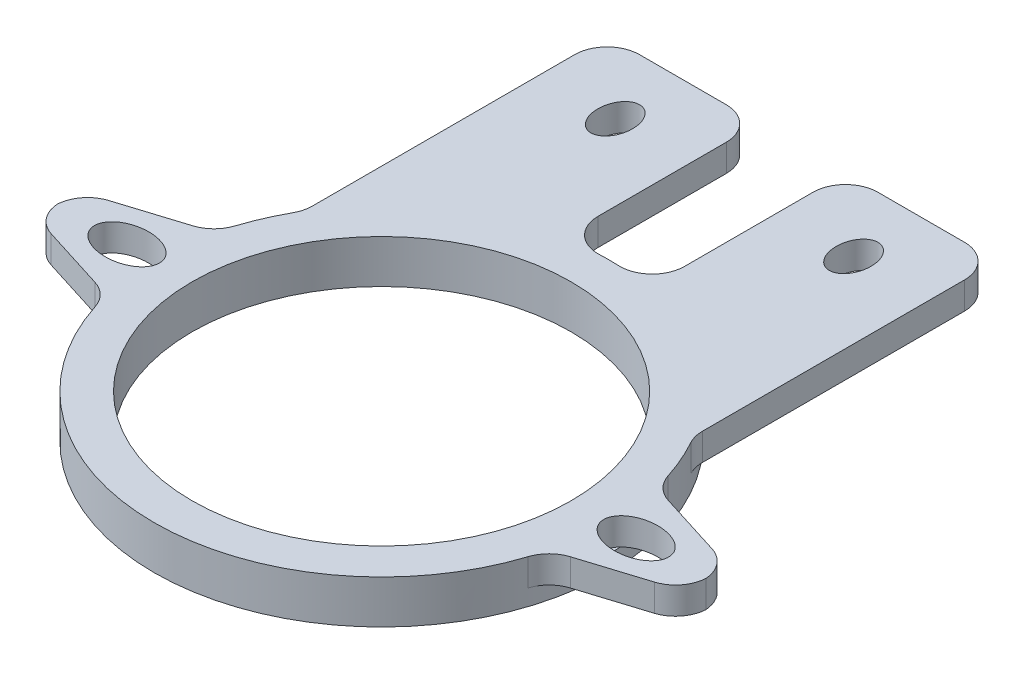
from build123d import *

# Parameters (mm, degrees)
SKETCH1_R           = 21
SKETCH1_R_2         = 17.5
BOSS_EXTRUDE1_DEPTH = 4
BOSS_EXTRUDE2_DEPTH = 2.5
SKETCH3_RX          = 2.25
SKETCH3_RY          = 1.6
SKETCH3_RX_2        = 3
SKETCH3_RY_2        = 2
CUT_EXTRUDE1_DEPTH  = 2.5
FILLET1_R           = 3


with BuildPart() as part:
    # Sketch1 → Boss-Extrude1 (new body)
    with BuildSketch(Plane(origin=(0, 0, 0), x_dir=(1, 0, 0), z_dir=(0, 1, 0))):
        with Locations(Location((0, 0, 0), (0, 0, 270))):
            Circle(SKETCH1_R)
        with Locations(Location((0, 0, 0), (0, 0, 270))):
            Circle(SKETCH1_R_2, mode=Mode.SUBTRACT)
    extrude(amount=BOSS_EXTRUDE1_DEPTH)

    # Sketch2 → Boss-Extrude2 (add)
    with BuildSketch(Plane(origin=(0, 4, 0), x_dir=(1, 0, 0), z_dir=(0, 1, 0))):
        Polygon((-20.396078054, 5), (-29.935470069, 2), (-29.935470069, -2), (-20.396078054, -5), align=None)
        Polygon((20.396078054, -5), (20.396078054, 5), (29.935470069, 2), (29.935470069, -2), align=None)
        Polygon((-18, 10.816653826), (-18, 38.816653826), (-4, 38.816653826), (-4, 20.615528128), align=None)
        Polygon((4, 20.615528128), (18, 10.816653826), (18, 38.816653826), (4, 38.816653826), align=None)
    extrude(amount=-BOSS_EXTRUDE2_DEPTH)

    # Sketch3 → Cut-Extrude1 (cut)
    with BuildSketch(Plane(origin=(0, 4, 0), x_dir=(1, 0, 0), z_dir=(0, 1, 0))):
        with Locations(Location((-11, 32.566653826), (0, 0, 90))):
            Ellipse(SKETCH3_RX, SKETCH3_RY)
        with Locations(Location((11, 32.566653826), (0, 0, 90))):
            Ellipse(SKETCH3_RX, SKETCH3_RY)
        with Locations((-23.5, 0)):
            Ellipse(SKETCH3_RX_2, SKETCH3_RY_2)
        with Locations(Location((23.5, 0), (0, 0, 180))):
            Ellipse(SKETCH3_RX_2, SKETCH3_RY_2)
    extrude(amount=-CUT_EXTRUDE1_DEPTH, mode=Mode.SUBTRACT)

    # Fillet1
    # the kernel refuses this fillet: 3 mm, written as the material it adds along each edge
    with BuildSketch(Plane(origin=(-18, 4, -10.816653826), x_dir=(-0.4996806126682358, 0, 0.8662097236371205), z_dir=(0, -1, 0))) as fillet1_piece_1:
        with BuildLine():
            CenterArc((0.804085058, 2.999521034), FILLET1_R, 240.021128247, 28.955024372)
            Line((-0.69495678, 0.400891863), (0, 0))
            ThreePointArc((0, 0), (0.375239694, 0.003352764), (0.750479387, 0))
        make_face()
    extrude(amount=2.5)
    with BuildSketch(Plane(origin=(-4, 4, -20.615528128), x_dir=(0.9932025912341629, 0, -0.11639850843436236), z_dir=(0, -1, 0))) as fillet1_piece_2:
        with BuildLine():
            CenterArc((3.371129229, -2.991569999), FILLET1_R, 94.296279982, 92.388015463)
            Line((0.391521455, -3.340765524), (0, 0))
            ThreePointArc((0, 0), (1.57319364, -0.05901001), (3.14638728, 0))
        make_face()
    extrude(amount=2.5)
    with BuildSketch(Plane(origin=(4, 4, -20.615528128), x_dir=(-0.9932025912341629, 0, -0.11639850843436243), z_dir=(0, -1, 0))) as fillet1_piece_3:
        with BuildLine():
            CenterArc((3.371129229, 2.991569999), FILLET1_R, 173.315704555, 92.388015463)
            Line((0.391521455, 3.340765524), (0, 0))
            ThreePointArc((0, 0), (1.57319364, 0.05901001), (3.14638728, 0))
        make_face()
    extrude(amount=2.5)
    with BuildSketch(Plane(origin=(18, 4, -10.816653826), x_dir=(0.4996806126682291, 0, 0.8662097236371242), z_dir=(0, -1, 0))) as fillet1_piece_4:
        with BuildLine():
            CenterArc((0.804085058, -2.999521034), FILLET1_R, 91.023847381, 28.955024372)
            Line((-0.69495678, -0.400891863), (0, 0))
            ThreePointArc((0, 0), (0.375239694, -0.003352764), (0.750479387, 0))
        make_face()
    extrude(amount=2.5)
    with BuildSketch(Plane(origin=(20.396078054, 4, -5), x_dir=(-0.2729089679529711, 0, -0.9620398615498447), z_dir=(0, -1, 0)), Plane(origin=(-20.396078054, 4, 5), x_dir=(0.2729089679529655, 0, 0.9620398615498462), z_dir=(0, -1, 0))) as fillet1_piece_5:
        with BuildLine():
            CenterArc((1.620157081, 2.998054992), FILLET1_R, 213.295044107, 54.641661907)
            Line((-0.88740746, 1.351203428), (0, 0))
            ThreePointArc((0, 0), (0.756073304, 0.013615053), (1.512146609, 0))
        make_face()
    extrude(amount=2.5)
    with BuildSketch(Plane(origin=(20.396078054, 4, 5), x_dir=(-0.2729089679529669, 0, 0.9620398615498458), z_dir=(0, -1, 0)), Plane(origin=(-20.396078054, 4, -5), x_dir=(0.27290896795296393, 0, -0.9620398615498467), z_dir=(0, -1, 0))) as fillet1_piece_6:
        with BuildLine():
            CenterArc((1.620157081, -2.998054992), FILLET1_R, 92.063293986, 54.641661907)
            Line((-0.88740746, -1.351203428), (0, 0))
            ThreePointArc((0, 0), (0.756073304, -0.013615053), (1.512146609, 0))
        make_face()
    extrude(amount=2.5)
    # the kernel refuses this fillet: 3 mm, written as the material it takes off along each edge
    with BuildSketch(Plane(origin=(-18, 11.5, -38.816653826), x_dir=(0, 0, 1), z_dir=(0, -1, 0)), Plane(origin=(-4, 11.5, -38.816653826), x_dir=(-1, 0, 0), z_dir=(0, -1, 0)), Plane(origin=(4, 11.5, -38.816653826), x_dir=(0, 0, 1), z_dir=(0, -1, 0)), Plane(origin=(18, 11.5, -38.816653826), x_dir=(-1, 0, 0), z_dir=(0, -1, 0))) as fillet1_2_piece_1:
        with BuildLine():
            CenterArc((FILLET1_R, -FILLET1_R), FILLET1_R, 90, 90)
            Line((0, -FILLET1_R), (0, 0))
            Line((0, 0), (FILLET1_R, 0))
        make_face()
    extrude(amount=17.5, mode=Mode.SUBTRACT)
    with BuildSketch(Plane(origin=(29.935470069, 9.503495393, -2), x_dir=(-0.9539392014169457, 0, -0.30000000000000027), z_dir=(0, -1, 0)), Plane(origin=(29.935470069, 9.503495393, 2), x_dir=(0, 0, -1), z_dir=(0, -1, 0)), Plane(origin=(-29.935470069, 9.503495393, 2), x_dir=(0.9539392014169454, 0, 0.3000000000000004), z_dir=(0, -1, 0)), Plane(origin=(-29.935470069, 9.503495393, -2), x_dir=(0, 0, 1), z_dir=(0, -1, 0))) as fillet1_2_piece_2:
        with BuildLine():
            CenterArc((FILLET1_R * 0.733799385705, -FILLET1_R), FILLET1_R, 90, 72.542396876)
            Line((-FILLET1_R * 0.220139815712, -FILLET1_R * 0.7), (0, 0))
            Line((0, 0), (FILLET1_R * 0.733799385705, 0))
        make_face()
    extrude(amount=13.506990786, mode=Mode.SUBTRACT)


solid = part.part
